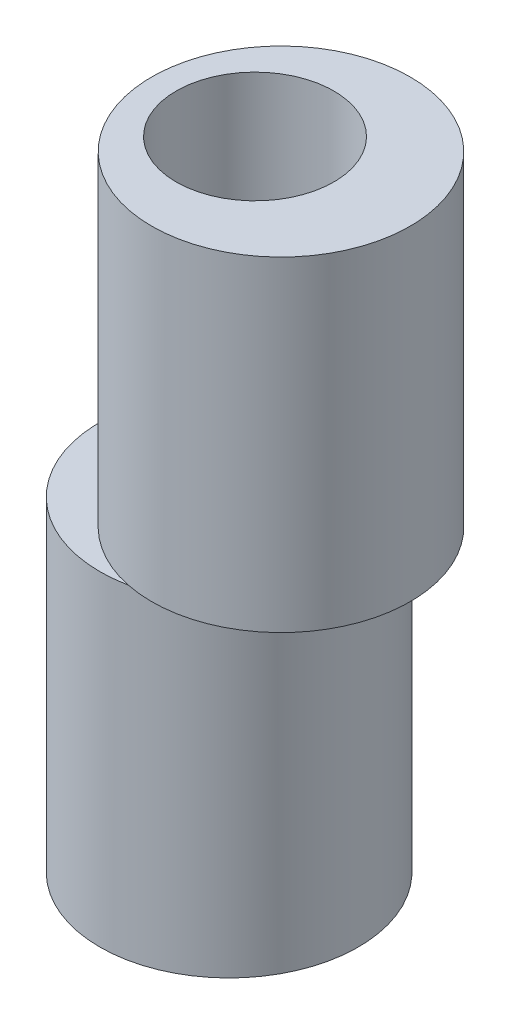
from build123d import *

# Parameters (mm, degrees)
SKETCH1_R               = 3.975
BOSS_EXTRUDE1_DEPTH     = 10
SKETCH2_R               = 3.975
BOSS_EXTRUDE2_DEPTH     = 10
CUT_EXTRUDE1_DEPTH      = 10
CUT_EXTRUDE1_DEPTH_BACK = 10
SKETCH4_R               = 2.425


with BuildPart() as part:
    # Sketch1 → Boss-Extrude1 (new body)
    with BuildSketch(Plane(origin=(0, 0, 0), x_dir=(1, 0, 0), z_dir=(0, 1, 0))):
        Circle(SKETCH1_R)
    extrude(amount=BOSS_EXTRUDE1_DEPTH)

    # Sketch2 → Boss-Extrude2 (add)
    with BuildSketch(Plane(origin=(0, 0, 0), x_dir=(1, 0, 0), z_dir=(0, 1, 0))):
        with Locations((-1.6, 0.004151236)):
            Circle(SKETCH2_R)
    extrude(amount=-BOSS_EXTRUDE2_DEPTH)

    # Sketch4 → Cut-Extrude1 (cut, two sides: drawn at the far end of the back side and taken through both)
    with BuildSketch(Plane(origin=(0, 0, 0), x_dir=(1, 0, 0), z_dir=(0, 1, 0)).offset(-CUT_EXTRUDE1_DEPTH_BACK)):
        with Locations((-0.8, 0.002075618)):
            Circle(SKETCH4_R)
    extrude(amount=CUT_EXTRUDE1_DEPTH + CUT_EXTRUDE1_DEPTH_BACK, mode=Mode.SUBTRACT)


solid = part.part
